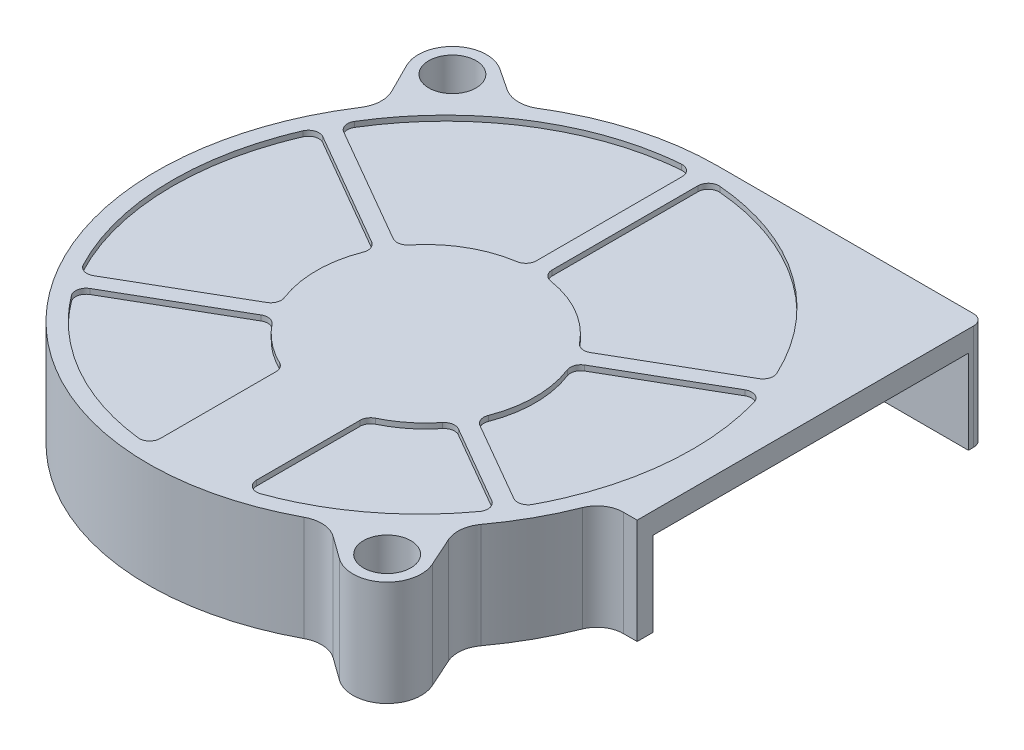
from build123d import *

# Parameters (mm, degrees)
SKETCH18_R          = 2.25
BOSS_EXTRUDE3_DEPTH = 2
CUT_EXTRUDE9_DEPTH  = 0.5
FILLET4_R           = 2.5
BOSS_EXTRUDE4_START = -8
SKETCH22_R          = 2.25
BOSS_EXTRUDE4_DEPTH = 8


with BuildPart() as part:
    # Sketch18 → Boss-Extrude3 (new body)
    with BuildSketch(Plane(origin=(0, 0, 0), x_dir=(1, 0, 0), z_dir=(0, 1, 0))):
        with BuildLine():
            Line((-23.005700489, 21.173936517), (-21.582450949, 18.333239239))
            ThreePointArc((-21.582450949, 18.333239239), (-21.290226852, 16.922030245), (-21.738588357, 15.552403394))
            add(Edge.make_bspline(
                [(-21.738588357, 15.552403394), (-74.642199686, -65.790312539), (9.324862756, -20.895925284)],
                knots=[4.619035423, 4.619035423, 4.619035423, 7.234825226, 7.234825226, 7.234825226], degree=2, weights=[1, 0.259883374, 1]))
            ThreePointArc((9.324862756, -20.895925284), (10.831803609, -20.571378647), (12.282148638, -21.093586031))
            Line((12.282148638, -21.093586031), (14.423232763, -22.636631148))
            ThreePointArc((14.423232763, -22.636631148), (18.378398581, -22.5178413), (19.287328639, -18.666699414))
            Line((19.287328639, -18.666699414), (18.031066286, -15.874036932))
            ThreePointArc((18.031066286, -15.874036932), (17.800260945, -14.429576005), (18.329372436, -13.065838675))
            add(Edge.make_bspline(
                [(18.329372436, -13.065838675), (20.952057231, -9.501687367), (22.333293139, -5.3)],
                knots=[1.416240338, 1.416240338, 1.416240338, 1.752231262, 1.752231262, 1.752231262], degree=2, weights=[1, 0.985921919, 1]))
            Line((22.333293139, -5.3), (25.4, -5.3))
            Line((25.4, -5.3), (25.4, 26.7))
            ThreePointArc((25.4, 26.7), (25.107106781, 27.407106781), (24.4, 27.7))
            Line((24.4, 27.7), (-0.010581904, 27.7))
            add(Edge.make_bspline(
                [(-0.010581904, 27.7), (-7.028971285, 27.7), (-13.197915422, 23.907683644)],
                knots=[3.605852843, 3.605852843, 3.605852843, 4.154921422, 4.154921422, 4.154921422], degree=2, weights=[1, 0.962551555, 1]))
            ThreePointArc((-13.197915422, 23.907683644), (-14.708437667, 23.493357847), (-16.205141277, 23.955117118))
            Line((-16.205141277, 23.955117118), (-18.311498324, 25.343379249))
            ThreePointArc((-18.311498324, 25.343379249), (-22.258262373, 25.059651887), (-23.005700489, 21.173936517))
        make_face()
        with Locations((16.3234107, -20)):
            Circle(SKETCH18_R, mode=Mode.SUBTRACT)
        with Locations((-20.1, 22.629754043)):
            Circle(SKETCH18_R, mode=Mode.SUBTRACT)
    extrude(amount=BOSS_EXTRUDE3_DEPTH)

    # Sketch21 → Cut-Extrude9 (cut)
    with BuildSketch(Plane.XZ.offset(-2)):
        with BuildLine():
            Line((9.380671427, 6.281958578), (16.889664258, 10.61727761))
            ThreePointArc((16.889664258, 10.61727761), (17.367921917, 11.27590978), (17.198057734, 12.071945509))
            add(Edge.make_bspline(
                [(17.198057734, 12.071945509), (12.554899126, 18.448479912), (5.336676879, 21.029359579)],
                knots=[1.72060662, 1.72060662, 1.72060662, 2.341313714, 2.341313714, 2.341313714], degree=2, weights=[1, 0.952225658, 1]))
            ThreePointArc((5.336676879, 21.029359579), (4.424099348, 20.905259025), (4, 20.087739337))
            Line((4, 20.087739337), (4, 10.24499878))
            ThreePointArc((4, 10.24499878), (4.151885476, 9.715185837), (4.561403509, 9.346314676))
            ThreePointArc((4.561403509, 9.346314676), (6.487216138, 8.128716183), (8.101665162, 6.520967843))
            ThreePointArc((8.101665162, 6.520967843), (8.696980161, 6.164999994), (9.380671427, 6.281958578))
        make_face()
        with BuildLine():
            Line((10.130671427, 4.982920472), (17.749498035, 9.381652065))
            ThreePointArc((17.749498035, 9.381652065), (18.524335906, 9.477117246), (19.131663578, 8.9865661))
            add(Edge.make_bspline(
                [(21.249872044, -9.970202217), (24.056123087, -0.237950121), (19.131663578, 8.9865661)],
                knots=[0.769514416, 0.769514416, 0.769514416, 1.572568981, 1.572568981, 1.572568981], degree=2, weights=[1, 0.920465168, 1]))
            ThreePointArc((21.249872044, -9.970202217), (20.662940109, -10.620604923), (19.789018765, -10.559169907))
            Line((19.789018765, -10.559169907), (10.130671427, -4.982920472))
            ThreePointArc((10.130671427, -4.982920472), (9.68753669, -4.449305759), (9.69815639, -3.755763922))
            ThreePointArc((9.69815639, -3.755763922), (10.4, 0), (9.69815639, 3.755763922))
            ThreePointArc((9.69815639, 3.755763922), (9.68753669, 4.449305759), (10.130671427, 4.982920472))
        make_face()
        with BuildLine():
            Line((-10.130671427, -4.982920472), (-21.139286828, -11.338747537))
            ThreePointArc((-21.139286828, -11.338747537), (-21.9528823, -11.422278809), (-22.556709037, -10.870637315))
            add(Edge.make_bspline(
                [(-21.961052126, 10.614886102), (-27.404440798, 0.306158598), (-22.556709037, -10.870637315)],
                knots=[3.708622327, 3.708622327, 3.708622327, 4.627736191, 4.627736191, 4.627736191], degree=2, weights=[1, 0.896249109, 1]))
            ThreePointArc((-21.961052126, 10.614886102), (-21.353777236, 11.108813785), (-20.576761985, 11.013973667))
            Line((-20.576761985, 11.013973667), (-10.130671427, 4.982920472))
            ThreePointArc((-10.130671427, 4.982920472), (-9.68753669, 4.449305759), (-9.69815639, 3.755763922))
            ThreePointArc((-9.69815639, 3.755763922), (-10.4, 0), (-9.69815639, -3.755763922))
            ThreePointArc((-9.69815639, -3.755763922), (-9.68753669, -4.449305759), (-10.130671427, -4.982920472))
        make_face()
        with BuildLine():
            Line((9.380671427, -6.281958578), (19.541752537, -12.148461491))
            ThreePointArc((19.541752537, -12.148461491), (19.995803, -12.714840914), (19.947118982, -13.43911803))
            add(Edge.make_bspline(
                [(1.832210196, -26.124693311), (14.486982659, -25.080808446), (19.947118982, -13.43911803)],
                knots=[5.899428803, 5.899428803, 5.899428803, 6.896434086, 6.896434086, 6.896434086], degree=2, weights=[1, 0.87829945, 1]))
            ThreePointArc((1.832210196, -26.124693311), (1.072582181, -25.86367676), (0.75, -25.128078298))
            Line((0.75, -25.128078298), (0.75, -11.26487905))
            ThreePointArc((0.75, -11.26487905), (0.990556529, -10.614305753), (1.596491228, -10.276731764))
            ThreePointArc((1.596491228, -10.276731764), (5.2, -9.006664199), (8.101665162, -6.520967843))
            ThreePointArc((8.101665162, -6.520967843), (8.696980161, -6.164999994), (9.380671427, -6.281958578))
        make_face()
        with BuildLine():
            Line((-4, 10.24499878), (-4, 21.25280893))
            ThreePointArc((-4, 21.25280893), (-4.335734031, 22.000305233), (-5.117501446, 22.245881642))
            add(Edge.make_bspline(
                [(-5.117501446, 22.245881642), (-14.362152408, 21.152044459), (-19.994447245, 13.707442628)],
                knots=[2.791698852, 2.791698852, 2.791698852, 3.552181829, 3.552181829, 3.552181829], degree=2, weights=[1, 0.928575035, 1]))
            ThreePointArc((-19.994447245, 13.707442628), (-20.177080874, 12.905669736), (-19.696965717, 12.238073863))
            Line((-19.696965717, 12.238073863), (-9.380671427, 6.281958578))
            ThreePointArc((-9.380671427, 6.281958578), (-8.696980161, 6.164999994), (-8.101665162, 6.520967843))
            ThreePointArc((-8.101665162, 6.520967843), (-6.487216138, 8.128716183), (-4.561403509, 9.346314676))
            ThreePointArc((-4.561403509, 9.346314676), (-4.151885476, 9.715185837), (-4, 10.24499878))
        make_face()
        with BuildLine():
            Line((-9.380671427, -6.281958578), (-20.52543024, -12.716388078))
            ThreePointArc((-20.52543024, -12.716388078), (-20.994462803, -13.335480514), (-20.878910009, -14.103539458))
            add(Edge.make_bspline(
                [(-20.878910009, -14.103539458), (-14.140957085, -25.138695581), (-1.830055545, -26.127424933)],
                knots=[4.775770168, 4.775770168, 4.775770168, 5.742874897, 5.742874897, 5.742874897], degree=2, weights=[1, 0.885348922, 1]))
            ThreePointArc((-1.830055545, -26.127424933), (-1.071787476, -25.865500348), (-0.75, -25.130634529))
            Line((-0.75, -25.130634529), (-0.75, -11.26487905))
            ThreePointArc((-0.75, -11.26487905), (-0.990556529, -10.614305753), (-1.596491228, -10.276731764))
            ThreePointArc((-1.596491228, -10.276731764), (-5.2, -9.006664199), (-8.101665162, -6.520967843))
            ThreePointArc((-8.101665162, -6.520967843), (-8.696980161, -6.164999994), (-9.380671427, -6.281958578))
        make_face()
    extrude(amount=CUT_EXTRUDE9_DEPTH, mode=Mode.SUBTRACT)

    # Fillet4
    fillet4_edges = [part.edges().sort_by_distance(p)[0] for p in [
        (22.333293139, 1, 5.3),
    ]]
    fillet(fillet4_edges, radius=FILLET4_R)

    # Sketch22 → Boss-Extrude4 (add)
    with BuildSketch(Plane(origin=(0, 0, 0), x_dir=(1, 0, 0), z_dir=(0, 1, 0)).offset(BOSS_EXTRUDE4_START)):
        with BuildLine():
            Line((25.4, 26.2), (0.134529672, 26.2))
            add(Edge.make_bspline(
                [(0.134529672, 26.2), (-45.132401673, 26.493894021), (-21.1535928, -12.020990224), (2.825216073, -50.535874469), (20.373398026, -6.307772844)],
                knots=[0.456497732, 0.456497732, 0.456497732, 2.643550488, 2.643550488, 4.830603244, 4.830603244, 4.830603244], degree=2, weights=[1, 0.459355916, 1, 0.459355916, 1]))
            ThreePointArc((20.373398026, -6.307772844), (21.845090667, -4.485719639), (24.084632068, -3.8))
            Line((24.084632068, -3.8), (25.4, -3.8))
            Line((25.4, -3.8), (25.4, -5.3))
            Line((25.4, -5.3), (24.084632068, -5.3))
            ThreePointArc((24.084632068, -5.3), (22.680778329, -5.731378556), (21.761398508, -6.876644257))
            add(Edge.make_bspline(
                [(18.329372436, -13.065838675), (20.443306322, -10.193064851), (21.761398508, -6.876644257)],
                knots=[1.416240338, 1.416240338, 1.416240338, 1.687948198, 1.687948198, 1.687948198], degree=2, weights=[1, 0.990786039, 1]))
            ThreePointArc((18.329372436, -13.065838675), (17.800260945, -14.429576005), (18.031066286, -15.874036932))
            Line((18.031066286, -15.874036932), (19.287328639, -18.666699414))
            ThreePointArc((19.287328639, -18.666699414), (18.378398581, -22.5178413), (14.423232763, -22.636631148))
            Line((14.423232763, -22.636631148), (12.282148638, -21.093586031))
            ThreePointArc((12.282148638, -21.093586031), (10.831803609, -20.571378647), (9.324862756, -20.895925284))
            add(Edge.make_bspline(
                [(-21.738588357, 15.552403394), (-74.642199686, -65.790312539), (9.324862756, -20.895925284)],
                knots=[4.619035423, 4.619035423, 4.619035423, 7.234825226, 7.234825226, 7.234825226], degree=2, weights=[1, 0.259883374, 1]))
            ThreePointArc((-21.738588357, 15.552403394), (-21.290226852, 16.922030245), (-21.582450949, 18.333239239))
            Line((-21.582450949, 18.333239239), (-23.005700489, 21.173936517))
            ThreePointArc((-23.005700489, 21.173936517), (-22.258262373, 25.059651887), (-18.311498324, 25.343379249))
            Line((-18.311498324, 25.343379249), (-16.205141277, 23.955117118))
            ThreePointArc((-16.205141277, 23.955117118), (-14.708437667, 23.493357847), (-13.197915422, 23.907683644))
            add(Edge.make_bspline(
                [(-0.010581904, 27.7), (-7.028971285, 27.7), (-13.197915422, 23.907683644)],
                knots=[3.605852843, 3.605852843, 3.605852843, 4.154921422, 4.154921422, 4.154921422], degree=2, weights=[1, 0.962551555, 1]))
            Line((-0.010581904, 27.7), (24.4, 27.7))
            ThreePointArc((24.4, 27.7), (25.107106781, 27.407106781), (25.4, 26.7))
            Line((25.4, 26.7), (25.4, 26.2))
        make_face()
        with Locations((16.3234107, -20)):
            Circle(SKETCH22_R, mode=Mode.SUBTRACT)
        with Locations((-20.1, 22.629754043)):
            Circle(SKETCH22_R, mode=Mode.SUBTRACT)
    extrude(amount=BOSS_EXTRUDE4_DEPTH)


solid = part.part
